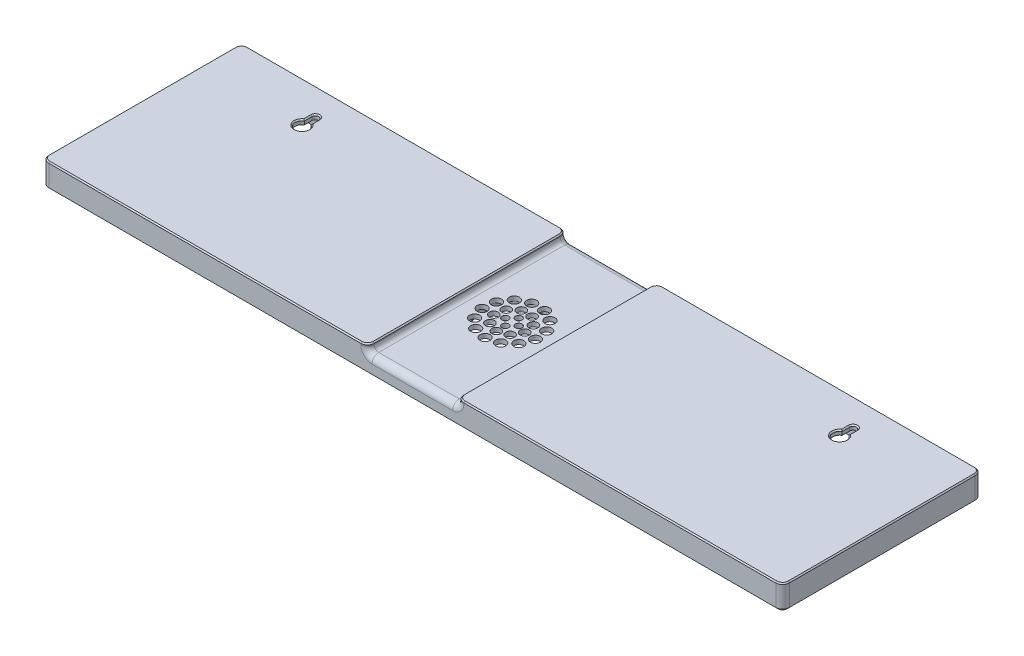
from build123d import *

# Parameters (mm, degrees)
SKETCH1_W           = 326.5
SKETCH1_H           = 85
SKETCH1_W_2         = 322.5
SKETCH1_H_2         = 81
BOSS_EXTRUDE1_DEPTH = 10
SKETCH2_W           = 330.5
SKETCH2_H           = 89
SKETCH2_W_2         = 322.5
SKETCH2_H_2         = 81
BOSS_EXTRUDE2_DEPTH = 8
SKETCH3_W           = 330.5
SKETCH3_H           = 89
BOSS_EXTRUDE3_DEPTH = 2
FILLET1_R           = 3
FILLET2_R           = 2
FILLET3_R           = 3
CHAMFER1_SIZE       = 0.5
CUT_EXTRUDE1_DEPTH  = 172.557024047
CHAMFER2_SIZE       = 0.5
SKETCH7_W           = 40
SKETCH7_H           = 6.166023439
CUT_EXTRUDE3_DEPTH  = 189.075948755
BOSS_EXTRUDE4_REACH = 190.076
FILLET4_R           = 2
CHAMFER3_SIZE       = 0.5
FILLET5_R           = 3
FILLET6_R           = 2
SKETCH9_R           = 16.25
SKETCH9_R_2         = 14.25
BOSS_EXTRUDE5_DEPTH = 3
SKETCH10_R          = 1.5
SKETCH10_R_2        = 2
SKETCH10_R_3        = 2.25
CUT_EXTRUDE4_DEPTH  = 172.279924393
CHAMFER4_SIZE       = 0.5
SKETCH12_W          = 30.6
SKETCH12_H          = 39
SKETCH12_W_2        = 26.6
SKETCH12_H_2        = 35
BOSS_EXTRUDE6_DEPTH = 6
SKETCH13_W          = 30.6
SKETCH13_H          = 4
BOSS_EXTRUDE7_DEPTH = 2.7
SKETCH14_W          = 3.373769955
SKETCH14_H          = 15.899358316
SKETCH14_W_2        = 15.312861043
SKETCH14_H_2        = 6.106571476
SKETCH14_W_3        = 6.70369678
SKETCH14_H_3        = 18.082973575
CUT_EXTRUDE5_DEPTH  = 6
FILLET7_R           = 2
CUT_EXTRUDE6_DEPTH  = 12.7
SKETCH19_W          = 25
SKETCH19_H          = 25.3
SKETCH19_W_2        = 21
SKETCH19_H_2        = 21.3
BOSS_EXTRUDE8_DEPTH = 6
SKETCH20_W          = 17
SKETCH20_H          = 11.292116592
CUT_EXTRUDE9_DEPTH  = 6
FILLET8_R           = 2
FILLET9_R           = 2
FILLET10_R          = 1


with BuildPart() as part:
    # Sketch1 → Boss-Extrude1 (new body)
    with BuildSketch(Plane(origin=(0, 0, 0), x_dir=(1, 0, 0), z_dir=(0, 1, 0))):
        Rectangle(SKETCH1_W, SKETCH1_H)
        Rectangle(SKETCH1_W_2, SKETCH1_H_2, mode=Mode.SUBTRACT)
    extrude(amount=BOSS_EXTRUDE1_DEPTH)

    # Sketch2 → Boss-Extrude2 (add)
    with BuildSketch(Plane(origin=(0, 10, 0), x_dir=(1, 0, 0), z_dir=(0, 1, 0))):
        Rectangle(SKETCH2_W, SKETCH2_H)
        Rectangle(SKETCH2_W_2, SKETCH2_H_2, mode=Mode.SUBTRACT)
    extrude(amount=-BOSS_EXTRUDE2_DEPTH)

    # Sketch3 → Boss-Extrude3 (add)
    with BuildSketch(Plane(origin=(0, 10, 0), x_dir=(1, 0, 0), z_dir=(0, 1, 0))):
        Rectangle(SKETCH3_W, SKETCH3_H)
    extrude(amount=BOSS_EXTRUDE3_DEPTH)

    # Fillet1
    fillet1_edges = [part.edges().sort_by_distance(p)[0] for p in [
        (161.25, 5, 40.5),
        (161.25, 5, -40.5),
        (-161.25, 5, -40.5),
        (-161.25, 5, 40.5),
    ]]
    fillet(fillet1_edges, radius=FILLET1_R)

    # Fillet2
    fillet2_edges = [part.edges().sort_by_distance(p)[0] for p in [
        (163.25, 1, 42.5),
        (-163.25, 1, 42.5),
        (-163.25, 1, -42.5),
        (163.25, 1, -42.5),
    ]]
    fillet(fillet2_edges, radius=FILLET2_R)

    # Fillet3
    fillet3_edges = [part.edges().sort_by_distance(p)[0] for p in [
        (165.25, 7, -44.5),
        (165.25, 7, 44.5),
        (-165.25, 7, 44.5),
        (-165.25, 7, -44.5),
    ]]
    fillet(fillet3_edges, radius=FILLET3_R)

    # Chamfer1
    chamfer1_edges = [part.edges().sort_by_distance(p)[0] for p in [
        (165.25, 12, 0),
        (-165.25, 12, 0),
        (0, 12, 44.5),
        (0, 12, -44.5),
        (-164.371320344, 12, -43.621320344),
        (-164.371320344, 12, 43.621320344),
        (164.371320344, 12, 43.621320344),
        (164.371320344, 12, -43.621320344),
    ]]
    chamfer(chamfer1_edges, length=CHAMFER1_SIZE)

    # Sketch4 → Cut-Extrude1 (cut, through all)
    with BuildSketch(Plane(origin=(0, 12, 0), x_dir=(1, 0, 0), z_dir=(0, 1, 0))):
        with BuildLine():
            Line((-121.5, 32.222687085), (-121.5, 28.820763297))
            ThreePointArc((-121.5, 28.820763297), (-120, 23.222687085), (-118.5, 28.820763297))
            Line((-118.5, 28.820763297), (-118.5, 32.222687085))
            ThreePointArc((-118.5, 32.222687085), (-120, 33.722687085), (-121.5, 32.222687085))
        make_face()
        with BuildLine():
            Line((118.5, 32.222687085), (118.5, 28.820763297))
            ThreePointArc((118.5, 28.820763297), (120, 23.222687085), (121.5, 28.820763297))
            Line((121.5, 28.820763297), (121.5, 32.222687085))
            ThreePointArc((121.5, 32.222687085), (120, 33.722687085), (118.5, 32.222687085))
        make_face()
    extrude(amount=-CUT_EXTRUDE1_DEPTH, mode=Mode.SUBTRACT)

    # Chamfer2
    chamfer2_edges = [part.edges().sort_by_distance(p)[0] for p in [
        (-120, 12, -33.722687085),
        (-121.5, 12, -30.521725191),
        (-120, 12, -23.222687085),
        (-118.5, 12, -30.521725191),
        (120, 12, -33.722687085),
        (118.5, 12, -30.521725191),
        (120, 12, -23.222687085),
        (121.5, 12, -30.521725191),
    ]]
    chamfer(chamfer2_edges, length=CHAMFER2_SIZE)

    # Sketch7 → Cut-Extrude3 (cut, through all)
    with BuildSketch(Plane(origin=(0, 0, -44.5), x_dir=(-1, 0, 0), z_dir=(0, 0, -1))):
        with Locations((0, 12.083011719)):
            Rectangle(SKETCH7_W, SKETCH7_H)
    extrude(amount=-CUT_EXTRUDE3_DEPTH, mode=Mode.SUBTRACT)

    # Boss-Extrude4: up to this face of the body (flat: up to its plane)
    boss_extrude4_end = Plane(part.part.faces().sort_by_distance((0, 6.63265862, 44.5))[0])
    # Sketch8 → Boss-Extrude4 (add, up to the picked face)
    with BuildSketch(Plane(origin=(0, 0, -44.5), x_dir=(-1, 0, 0), z_dir=(0, 0, -1)), mode=Mode.PRIVATE) as boss_extrude4_sk1:
        Polygon((-20, 12), (-20, 9), (20, 9), (20, 12), (22, 12), (22, 7), (-22, 7), (-22, 12), align=None)
    boss_extrude4_tool1 = split(extrude(boss_extrude4_sk1.sketch, amount=-BOSS_EXTRUDE4_REACH, mode=Mode.PRIVATE), bisect_by=boss_extrude4_end, keep=Keep.BOTH, mode=Mode.PRIVATE)
    add(boss_extrude4_tool1.solids().sort_by(Axis((0, 8.3, -44.5), (0, 0, 1)))[0])

    # Fillet4
    fillet4_edges = [part.edges().sort_by_distance(p)[0] for p in [
        (-20, 9, 0),
        (20, 9, 0),
    ]]
    fillet(fillet4_edges, radius=FILLET4_R)

    # Chamfer3
    chamfer3_edges = [part.edges().sort_by_distance(p)[0] for p in [
        (-21, 12, 44.5),
        (21, 12, 44.5),
        (-21, 12, -44.5),
        (21, 12, -44.5),
    ]]
    chamfer(chamfer3_edges, length=CHAMFER3_SIZE - 0.0001)  # a hair under: the kernel refuses the full size

    # Fillet5
    fillet5_edges = [part.edges().sort_by_distance(p)[0] for p in [
        (20, 11.25005, 44.5),
        (19.414213562, 9.585786438, 44.5),
        (-20, 11.25005, 44.5),
        (-19.414213562, 9.585786438, 44.5),
        (20, 11.25005, -44.5),
        (19.414213562, 9.585786438, -44.5),
        (-20, 11.25005, -44.5),
        (-19.414213562, 9.585786438, -44.5),
        (0, 9, -44.5),
        (0, 9, 44.5),
    ]]
    fillet(fillet5_edges, radius=FILLET5_R)

    # Fillet6
    fillet6_edges = [part.edges().sort_by_distance(p)[0] for p in [
        (22, 10, 0),
        (-22, 10, 0),
    ]]
    fillet(fillet6_edges, radius=FILLET6_R)

    # Sketch9 → Boss-Extrude5 (add)
    with BuildSketch(Plane.XZ.offset(-7)):
        Circle(SKETCH9_R)
        Circle(SKETCH9_R_2, mode=Mode.SUBTRACT)
    extrude(amount=BOSS_EXTRUDE5_DEPTH)

    # Sketch10 → Cut-Extrude4 (cut, through all)
    with BuildSketch(Plane.XZ.offset(-7)):
        with Locations((0, 3)):
            Circle(SKETCH10_R)
        with Locations((0, 7)):
            Circle(SKETCH10_R_2)
        with Locations((0, 12)):
            Circle(SKETCH10_R_3)
        with Locations((4.499513268, 5.362311102)):
            Circle(SKETCH10_R_2)
        with Locations((6.893654271, 1.215537244)):
            Circle(SKETCH10_R_2)
        with Locations((6.062177826, -3.5)):
            Circle(SKETCH10_R_2)
        with Locations((2.394141003, -6.577848346)):
            Circle(SKETCH10_R_2)
        with Locations((-2.394141003, -6.577848346)):
            Circle(SKETCH10_R_2)
        with Locations((-6.062177826, -3.5)):
            Circle(SKETCH10_R_2)
        with Locations((-6.893654271, 1.215537244)):
            Circle(SKETCH10_R_2)
        with Locations((-4.499513268, 5.362311102)):
            Circle(SKETCH10_R_2)
        with Locations((3, 0)):
            Circle(SKETCH10_R)
        with Locations((0, -3)):
            Circle(SKETCH10_R)
        with Locations((-3, 0)):
            Circle(SKETCH10_R)
        with Locations((5.576678065, 10.625472308)):
            Circle(SKETCH10_R_3)
        with Locations((9.875806391, 6.816776961)):
            Circle(SKETCH10_R_3)
        with Locations((11.912506489, 1.446440163)):
            Circle(SKETCH10_R_3)
        with Locations((11.220194912, -4.255258645)):
            Circle(SKETCH10_R_3)
        with Locations((7.957471899, -8.982128978)):
            Circle(SKETCH10_R_3)
        with Locations((2.871787971, -11.651301809)):
            Circle(SKETCH10_R_3)
        with Locations((-2.871787971, -11.651301809)):
            Circle(SKETCH10_R_3)
        with Locations((-7.957471899, -8.982128978)):
            Circle(SKETCH10_R_3)
        with Locations((-11.220194912, -4.255258645)):
            Circle(SKETCH10_R_3)
        with Locations((-11.912506489, 1.446440163)):
            Circle(SKETCH10_R_3)
        with Locations((-9.875806391, 6.816776961)):
            Circle(SKETCH10_R_3)
        with Locations((-5.576678065, 10.625472308)):
            Circle(SKETCH10_R_3)
    extrude(amount=-CUT_EXTRUDE4_DEPTH, mode=Mode.SUBTRACT)

    # Chamfer4
    chamfer4_edges = [part.edges().sort_by_distance(p)[0] for p in [
        (-20.35666074, 12, -42.918716869),
        (-20.35666074, 12, 42.918716869),
        (-20, 12, 0),
        (20.35666074, 12, 42.918716869),
        (20.35666074, 12, -42.918716869),
        (20, 12, 0),
    ]]
    chamfer(chamfer4_edges, length=CHAMFER4_SIZE - 0.0001)  # a hair under: the kernel refuses the full size

    # Sketch12 → Boss-Extrude6 (add)
    with BuildSketch(Plane.XZ.offset(-10)):
        with Locations((142.95, 3)):
            Rectangle(SKETCH12_W, SKETCH12_H)
        with Locations((142.95, 3)):
            Rectangle(SKETCH12_W_2, SKETCH12_H_2, mode=Mode.SUBTRACT)
    extrude(amount=BOSS_EXTRUDE6_DEPTH)

    # Sketch13 → Boss-Extrude7 (add)
    with BuildSketch(Plane.XZ.offset(-10)):
        with Locations((142.95, -14.5)):
            Rectangle(SKETCH13_W, SKETCH13_H)
    extrude(amount=BOSS_EXTRUDE7_DEPTH)

    # Sketch14 → Cut-Extrude5 (cut)
    with BuildSketch(Plane.XZ.offset(-4)):
        with Locations((157.936884978, 16.074384573)):
            Rectangle(SKETCH14_W, SKETCH14_H)
        with Locations((143.337214565, 21.464137582)):
            Rectangle(SKETCH14_W_2, SKETCH14_H_2)
        with Locations((129.195604024, 2.873540073)):
            Rectangle(SKETCH14_W_3, SKETCH14_H_3)
    extrude(amount=-CUT_EXTRUDE5_DEPTH, mode=Mode.SUBTRACT)

    # Fillet7
    fillet7_edges = [part.edges().sort_by_distance(p)[0] for p in [
        (150.993645086, 7, 20.5),
        (135.680784043, 7, 20.5),
        (129.65, 7, 11.91502686),
        (156.25, 7, 8.124705415),
        (129.65, 7, -6.167946715),
    ]]
    fillet(fillet7_edges, radius=FILLET7_R - 0.0001)  # a hair under: the kernel refuses the full size

    # Sketch15 → Cut-Extrude6 (cut)
    with BuildSketch(Plane.XY.offset(-40.5)):
        with BuildLine():
            Line((142.732418969, 8.83308219), (145.68707631, 8.83308219))
            ThreePointArc((145.68707631, 8.83308219), (146.85974764, 6.63308219), (145.68707631, 4.43308219))
            Line((145.68707631, 4.43308219), (142.732418969, 4.43308219))
            ThreePointArc((142.732418969, 4.43308219), (141.55974764, 6.63308219), (142.732418969, 8.83308219))
        make_face()
    extrude(amount=-CUT_EXTRUDE6_DEPTH, mode=Mode.SUBTRACT)

    # Sketch19 → Boss-Extrude8 (add)
    with BuildSketch(Plane.XZ.offset(-10)):
        with Locations((48.241330984, -14.734055582)):
            Rectangle(SKETCH19_W, SKETCH19_H)
        with Locations((48.241330984, -14.734055582)):
            Rectangle(SKETCH19_W_2, SKETCH19_H_2, mode=Mode.SUBTRACT)
    extrude(amount=BOSS_EXTRUDE8_DEPTH)

    # Sketch20 → Cut-Extrude9 (cut)
    with BuildSketch(Plane.XZ.offset(-4)):
        with Locations((48.241330984, -27.384055582)):
            Rectangle(SKETCH20_W, SKETCH20_H)
    extrude(amount=-CUT_EXTRUDE9_DEPTH, mode=Mode.SUBTRACT)

    # Fillet8
    fillet8_edges = [part.edges().sort_by_distance(p)[0] for p in [
        (39.741330984, 7, -25.384055582),
        (56.741330984, 7, -25.384055582),
    ]]
    fillet(fillet8_edges, radius=FILLET8_R - 0.0001)  # a hair under: the kernel refuses the full size

    # Fillet9
    fillet9_edges = [part.edges().sort_by_distance(p)[0] for p in [
        (60.741330984, 7, -2.084055582),
        (35.741330984, 7, -2.084055582),
        (158.25, 7, -16.5),
        (127.65, 7, 22.5),
        (127.65, 7, -16.5),
    ]]
    fillet(fillet9_edges, radius=FILLET9_R)

    # Fillet10
    fillet10_edges = [part.edges().sort_by_distance(p)[0] for p in [
        (-16.25, 4, 0),
        (-16.25, 7, 0),
        (-14.25, 4, 0),
    ]]
    fillet(fillet10_edges, radius=FILLET10_R - 0.0001)  # a hair under: the kernel refuses the full size


solid = part.part
